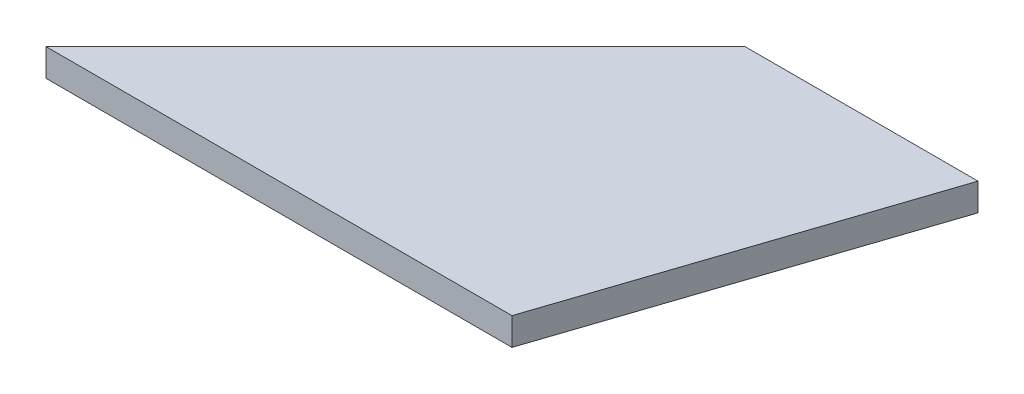
from build123d import *

# Parameters (mm, degrees)
BOSS_EXTRUDE1_DEPTH = 3


with BuildPart() as part:
    # Sketch1 → Boss-Extrude1 (new body)
    with BuildSketch(Plane(origin=(0, 0, 0), x_dir=(1, 0, 0), z_dir=(0, 1, 0))):
        Polygon((0, 0), (50.8, 0), (63.5, 38.1), (38.1, 38.1), align=None)
    extrude(amount=BOSS_EXTRUDE1_DEPTH)


solid = part.part
